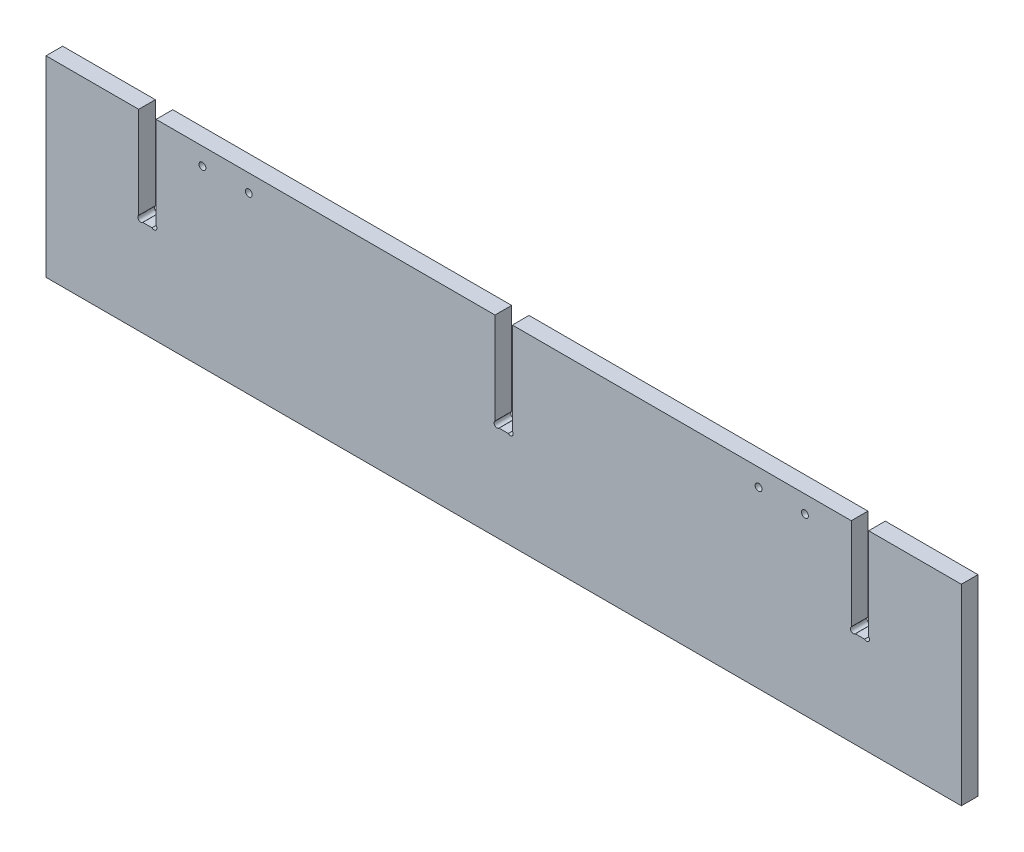
from build123d import *

# Parameters (mm, degrees)
SKETCH1_W                        = 1003.3
SKETCH1_H                        = 210.34375
BOSS_EXTRUDE1_DEPTH              = 18.25625
CUT_EXTRUDE1_DEPTH               = 18.25625
CUT_EXTRUDE2_DEPTH               = 18.25625
CUT_EXTRUDE3_DEPTH               = 18.25625
F_19_64_0_29688_DIAMETER_HOLE1_D = 7.540752


with BuildPart() as part:
    # Sketch1 → Boss-Extrude1 (new body)
    with BuildSketch(Plane.XY):
        with Locations((157.679571142, 134.40126838)):
            Rectangle(SKETCH1_W, SKETCH1_H)
    extrude(amount=BOSS_EXTRUDE1_DEPTH)

    # Sketch2 → Cut-Extrude1 (cut)
    with BuildSketch(Plane.XY.offset(18.25625)):
        with BuildLine():
            Line((148.154571142, 239.57314338), (167.204571142, 239.57314338))
            Line((167.204571142, 239.57314338), (167.204571142, 138.90727144))
            ThreePointArc((167.204571142, 138.90727144), (167.204571142, 134.41714338), (162.714443081, 134.41714338))
            Line((162.714443081, 134.41714338), (152.644699202, 134.41714338))
            ThreePointArc((152.644699202, 134.41714338), (148.154571142, 134.41714338), (148.154571142, 138.90727144))
            Line((148.154571142, 138.90727144), (148.154571142, 239.57314338))
        make_face()
    extrude(amount=-CUT_EXTRUDE1_DEPTH, mode=Mode.SUBTRACT)

    # Sketch2<4> → Cut-Extrude2 (cut)
    with BuildSketch(Plane.XY.offset(18.25625)):
        with BuildLine():
            Line((557.729571142, 239.57314338), (557.729571142, 138.90727144))
            ThreePointArc((557.729571142, 138.90727144), (557.729571142, 134.41714338), (553.239443081, 134.41714338))
            Line((553.239443081, 134.41714338), (543.169699202, 134.41714338))
            ThreePointArc((543.169699202, 134.41714338), (538.679571142, 134.41714338), (538.679571142, 138.90727144))
            Line((538.679571142, 138.90727144), (538.679571142, 239.57314338))
            Line((538.679571142, 239.57314338), (557.729571142, 239.57314338))
        make_face()
    extrude(amount=-CUT_EXTRUDE2_DEPTH, mode=Mode.SUBTRACT)

    # Sketch2<5> → Cut-Extrude3 (cut)
    with BuildSketch(Plane.XY.offset(18.25625)):
        with BuildLine():
            Line((-242.370428858, 239.57314338), (-223.320428858, 239.57314338))
            Line((-223.320428858, 239.57314338), (-223.320428858, 138.90727144))
            ThreePointArc((-223.320428858, 138.90727144), (-223.320428858, 134.41714338), (-227.810556919, 134.41714338))
            Line((-227.810556919, 134.41714338), (-237.880300798, 134.41714338))
            ThreePointArc((-237.880300798, 134.41714338), (-242.370428858, 134.41714338), (-242.370428858, 138.90727144))
            Line((-242.370428858, 138.90727144), (-242.370428858, 239.57314338))
        make_face()
    extrude(amount=-CUT_EXTRUDE3_DEPTH, mode=Mode.SUBTRACT)

    # 19/64 (0.29688) Diameter Hole1 (through all)
    with Locations(Plane(origin=(487.879571142, 220.52314338, 18.25625), x_dir=(1, 0, 0), z_dir=(0, 0, 1))):
        with Locations((0, 0), (-50.8, 0), (-660.4, 0), (-609.6, 0)):
            Hole(F_19_64_0_29688_DIAMETER_HOLE1_D / 2)


solid = part.part
